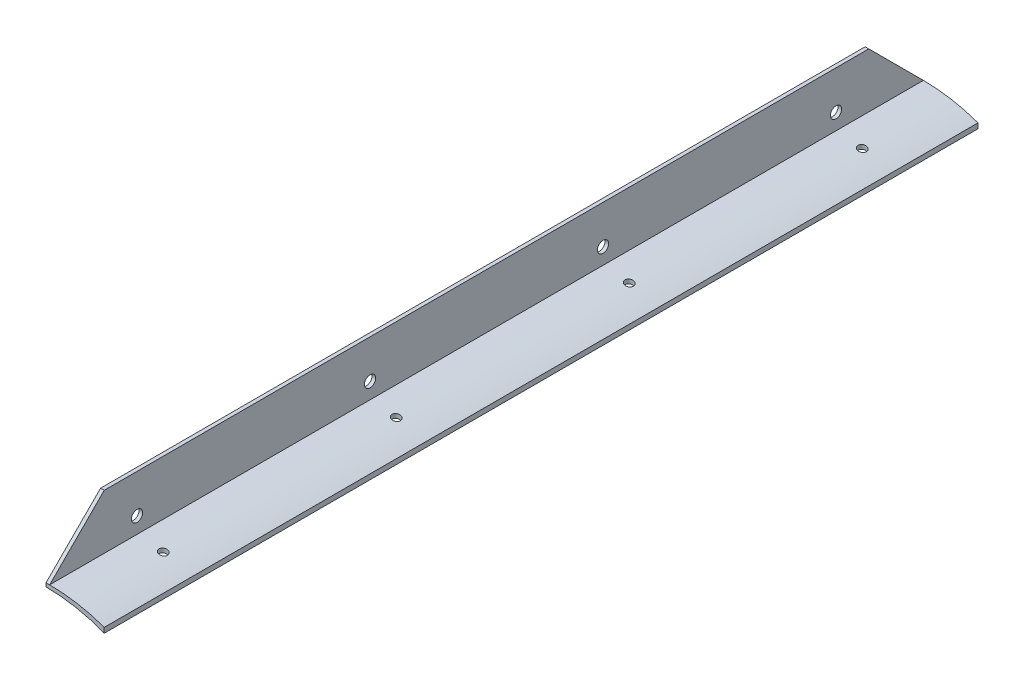
from build123d import *

# Parameters (mm, degrees)
EXTRUDE1_DEPTH               = 190.5
EXTRUDE2_DEPTH               = 387.35
F_6_CLEARANCE_HOLE1_D        = 3.6576
F_10_0_1935_DIAMETER_HOLE1_D = 4.9149
LPATTERN1_COUNT              = 4
LPATTERN1_PITCH              = 101.6


with BuildPart() as part:
    # Sketch1 → Extrude1 (new, symmetric)
    with BuildSketch(Plane.XY):
        with BuildLine():
            Line((0, 0), (0, 25.4))
            Line((0, 25.4), (1.5875, 25.4))
            Line((1.5875, 25.4), (1.5875, 1.5875))
            ThreePointArc((1.5875, 1.5875), (13.671867582, 0.546246178), (25.4, -2.546820159))
            Line((25.4, -2.546820159), (25.4, -4.781862636))
            ThreePointArc((25.4, -4.781862636), (12.923101507, -1.205874633), (0, 0))
        make_face()
    extrude(amount=EXTRUDE1_DEPTH, both=True)

    # Sketch2 → Extrude2 (cut)
    with BuildSketch(Plane.ZY):
        Polygon((190.5, 25.4), (166.6875, 25.4), (190.5, 1.5875), align=None)
    extrude2 = extrude(amount=-EXTRUDE2_DEPTH, mode=Mode.SUBTRACT)

    # Mirror2: Extrude2 across plane
    add(extrude2.mirror(Plane(origin=(0, 0, 0), x_dir=(1, 0, 0), z_dir=(0, 0, -1))), mode=Mode.SUBTRACT)

    # #6 Clearance Hole1 (through all)
    with Locations(Plane(origin=(0, 1.5875, 0), x_dir=(-1, 0, 0), z_dir=(0, 1, 0))):
        with Locations((-13.0175, -152.4)):
            f_6_clearance_hole1 = Hole(F_6_CLEARANCE_HOLE1_D / 2)

    # #10 (0.1935) Diameter Hole1 (through all)
    with Locations(Plane(origin=(1.5875, 8.5725, -152.4), x_dir=(0, 1, 0), z_dir=(1, 0, 0))):
        with Locations((0, 0)):
            f_10_0_1935_diameter_hole1 = Hole(F_10_0_1935_DIAMETER_HOLE1_D / 2)

    # LPattern1: #6 Clearance Hole1, #10 (0.1935) Diameter Hole1 ×4
    with Locations(*[(0, 0, i * LPATTERN1_PITCH) for i in range(1, LPATTERN1_COUNT)]):
        add(f_6_clearance_hole1, mode=Mode.SUBTRACT)
        add(f_10_0_1935_diameter_hole1, mode=Mode.SUBTRACT)


solid = part.part
